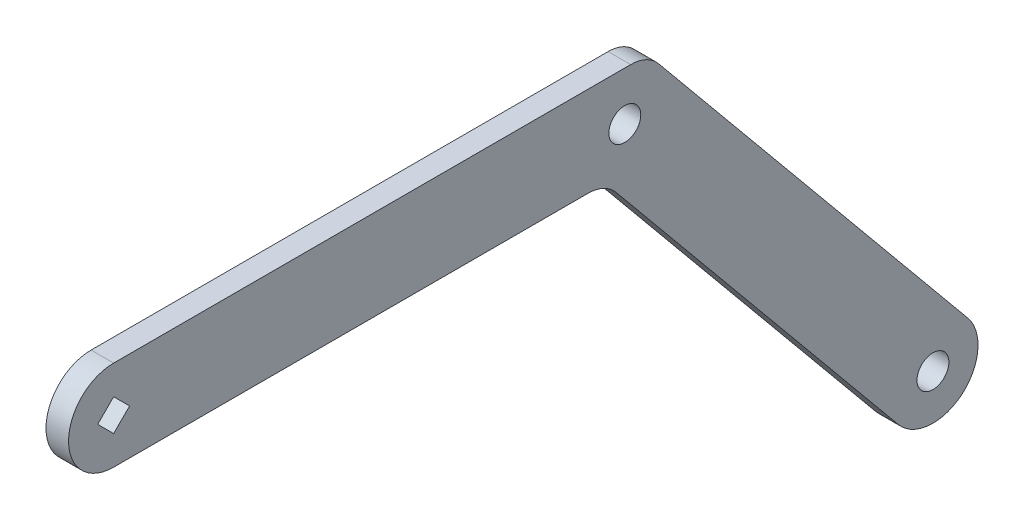
from build123d import *

# Parameters (mm, degrees)
SKETCH1_R               = 2.24506403
BOSS_EXTRUDE1_DEPTH     = 3.175
FILLET1_R               = 5.08
SKETCH2_R               = 2.2479
TORQUE_PREVENTION_DEPTH = 136.162605278


with BuildPart() as part:
    # Sketch1 → Boss-Extrude1 (new body)
    with BuildSketch(Plane(origin=(0, 0, 0), x_dir=(0, 0, -1), z_dir=(1, 0, 0))):
        with BuildLine():
            Line((0, -6.35), (69.215, -6.35))
            Line((69.215, -6.35), (110.472544626, -56.366360815))
            ThreePointArc((110.472544626, -56.366360815), (119.411735975, -57.224182484), (120.269557644, -48.284991135))
            Line((120.269557644, -48.284991135), (75.202192724, 6.35))
            Line((75.202192724, 6.35), (0, 6.35))
            ThreePointArc((0, 6.35), (-6.35, 0), (0, -6.35))
        make_face()
        with Locations((115.371051135, -52.325675975)):
            Circle(SKETCH1_R, mode=Mode.SUBTRACT)
        Polygon((0, 2.24506403), (2.24506403, 0), (0, -2.24506403), (-2.24506403, 0), align=None, mode=Mode.SUBTRACT)
    extrude(amount=BOSS_EXTRUDE1_DEPTH)

    # Fillet1
    fillet1_edges = [part.edges().sort_by_distance(p)[0] for p in [
        (1.5875, 6.35, -75.202192724),
        (1.5875, -6.35, -69.215),
    ]]
    fillet(fillet1_edges, radius=FILLET1_R)

    # Sketch2 → Torque prevention (cut, through all)
    with BuildSketch(Plane(origin=(3.175, 0, 0), x_dir=(0, 0, -1), z_dir=(1, 0, 0))):
        with Locations((71.979943731, -0.485016693)):
            Circle(SKETCH2_R)
    extrude(amount=-TORQUE_PREVENTION_DEPTH, mode=Mode.SUBTRACT)


solid = part.part
